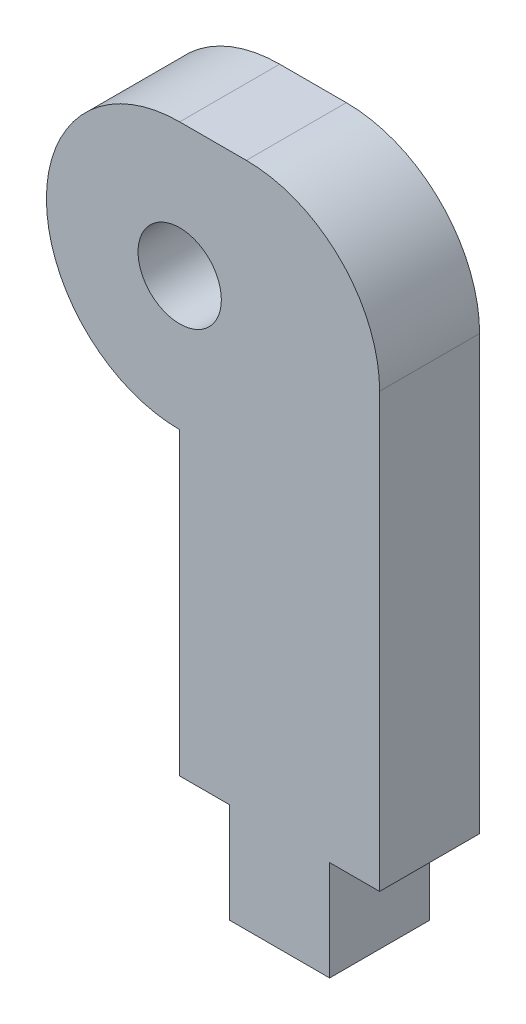
from build123d import *

# Parameters (mm, degrees)
SKETCH2_R           = 1.25
BOSS_EXTRUDE1_DEPTH = 3
FILLET1_R           = 4


with BuildPart() as part:
    # Sketch2 → Boss-Extrude1 (new body)
    with BuildSketch(Plane.XY):
        with BuildLine():
            Line((6, 4), (6, -13))
            Line((6, -13), (4.5, -13))
            Line((4.5, -13), (4.5, -16))
            Line((4.5, -16), (1.5, -16))
            Line((1.5, -16), (1.5, -13))
            Line((1.5, -13), (0, -13))
            Line((0, -13), (0, -4))
            ThreePointArc((0, -4), (-4, 0), (0, 4))
            Line((0, 4), (6, 4))
        make_face()
        Circle(SKETCH2_R, mode=Mode.SUBTRACT)
    extrude(amount=BOSS_EXTRUDE1_DEPTH)

    # Fillet1
    fillet1_edges = [part.edges().sort_by_distance(p)[0] for p in [
        (6, 4, 1.5),
    ]]
    fillet(fillet1_edges, radius=FILLET1_R)


solid = part.part
